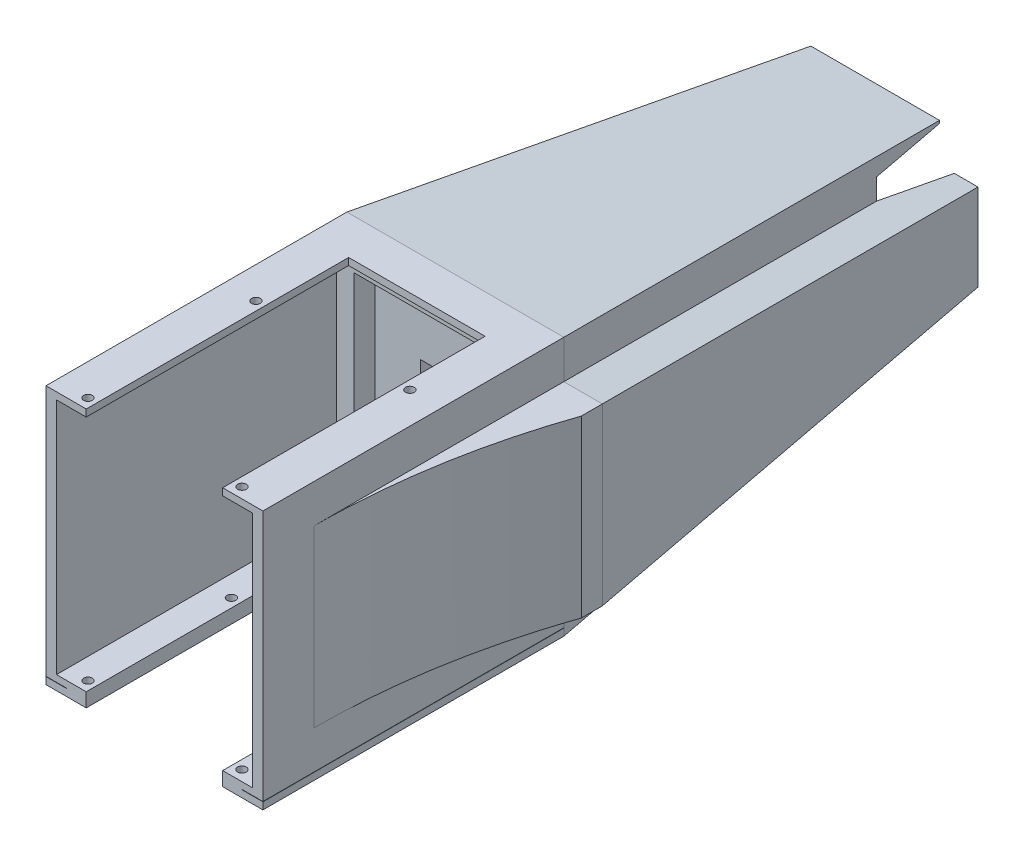
from build123d import *
from build123d.topology import SkipClean

# Parameters (mm, degrees)
BOSS_EXTRUDE1_DEPTH      = 3
SKETCH2_W                = 25
SKETCH2_H                = 2
BOSS_EXTRUDE2_DEPTH      = 40
SKETCH3_R                = 0.625
CUT_EXTRUDE1_DEPTH       = 3
SKETCH4_R                = 0.625
CUT_EXTRUDE2_DEPTH       = 3
SKETCH7_W                = 19.5
SKETCH7_H                = 75
CUT_EXTRUDE5_DEPTH       = 40
SKETCH10_W               = 25
SKETCH10_H               = 3
BOSS_EXTRUDE4_DEPTH      = 10
SKETCH11_W               = 25
SKETCH11_H               = 3
BOSS_EXTRUDE5_DEPTH      = 10
SKETCH12_W               = 3
SKETCH12_H               = 25
BOSS_EXTRUDE6_DEPTH      = 10
SKETCH13_W               = 3
SKETCH13_H               = 25
BOSS_EXTRUDE7_DEPTH      = 10
SKETCH14_W               = 43
SKETCH14_H               = 35.95813892
BOSS_EXTRUDE11_DEPTH     = 3
SKETCH15_W               = 43
SKETCH15_H               = 35.95813892
BOSS_EXTRUDE12_DEPTH     = 3
SKETCH16_W               = 23
SKETCH16_H               = 28
CUT_EXTRUDE6_DEPTH       = 13
FILLET1_R                = 10
FILLET2_R                = 10
SKETCH19_W               = 28
SKETCH19_H               = 32
CUT_EXTRUDE9_DEPTH       = 40
CUT_EXTRUDE11_DEPTH      = 58.835974964
CUT_EXTRUDE11_DEPTH_BACK = 58.835974964
SKETCH20_W               = 25.25
SKETCH20_H               = 11.847644437
SKETCH20_W_2             = 25
SKETCH20_H_2             = 13.837487399
CUT_EXTRUDE13_DEPTH      = 56.982140009
CUT_EXTRUDE13_DEPTH_BACK = 56.982140009
SKETCH22_W               = 10
SKETCH22_H               = 25
FILLET3_R                = 100
FILLET4_R                = 100
SKETCH25_W               = 28
SKETCH25_H               = 2
CUT_EXTRUDE17_DEPTH      = 40
SKETCH27_R               = 0.625
BOSS_EXTRUDE14_DEPTH     = 1
SKETCH31_W               = 10
SKETCH31_H               = 10
BOSS_EXTRUDE16_DEPTH     = 60
BOSS_EXTRUDE16_TAPER     = 6


# Some blends are built 0.0001 mm under size
with BuildPart() as part:
    # Sketch1 → Boss-Extrude1 (new body)
    with BuildSketch(Plane.XY):
        Polygon((12.5, 12.5), (21, 12.5), (21, -12.5), (12.5, -12.5), (12.5, -18), (-12.5, -18), (-12.5, -12.5), (-21, -12.5), (-21, 12.5), (-12.5, 12.5), (-12.5, 18), (12.5, 18), align=None)
    extrude(amount=BOSS_EXTRUDE1_DEPTH)

    # Sketch2 → Boss-Extrude2 (add)
    with BuildSketch(Plane.XY.offset(3)):
        with Locations((0, 17)):
            Rectangle(SKETCH2_W, SKETCH2_H)
        with Locations((0, -17)):
            Rectangle(SKETCH2_W, SKETCH2_H)
    extrude(amount=BOSS_EXTRUDE2_DEPTH)

    # Sketch3 → Cut-Extrude1 (cut)
    with BuildSketch(Plane(origin=(0, 18, 0), x_dir=(1, 0, 0), z_dir=(0, 1, 0))):
        with Locations(Location((-11, -17.5, 0), (0, 0, 270))):
            Circle(SKETCH3_R)
        with Locations(Location((11, -17.5, 0), (0, 0, 270))):
            Circle(SKETCH3_R)
        with Locations(Location((-11, -41.5, 0), (0, 0, 270))):
            Circle(SKETCH3_R)
        with Locations(Location((11, -41.5, 0), (0, 0, 270))):
            Circle(SKETCH3_R)
    extrude(amount=-CUT_EXTRUDE1_DEPTH, mode=Mode.SUBTRACT)

    # Sketch4 → Cut-Extrude2 (cut)
    with BuildSketch(Plane(origin=(0, -16, 0), x_dir=(1, 0, 0), z_dir=(0, 1, 0))):
        with Locations(Location((-11, -41.5, 0), (0, 0, 270))):
            Circle(SKETCH4_R)
        with Locations(Location((11, -41.5, 0), (0, 0, 270))):
            Circle(SKETCH4_R)
        with Locations(Location((-11, -21, 0), (0, 0, 270))):
            Circle(SKETCH4_R)
        with Locations(Location((11, -21, 0), (0, 0, 270))):
            Circle(SKETCH4_R)
    extrude(amount=-CUT_EXTRUDE2_DEPTH, mode=Mode.SUBTRACT)

    # Sketch7 → Cut-Extrude5 (cut)
    with BuildSketch(Plane(origin=(0, 18, 0), x_dir=(1, 0, 0), z_dir=(0, 1, 0))):
        with Locations((0, -43)):
            Rectangle(SKETCH7_W, SKETCH7_H)
    extrude(amount=-CUT_EXTRUDE5_DEPTH, mode=Mode.SUBTRACT)

    # Sketch10 → Boss-Extrude4 (add)
    with BuildSketch(Plane(origin=(0, 18, 0), x_dir=(1, 0, 0), z_dir=(0, 1, 0))):
        with Locations((0, -1.5)):
            Rectangle(SKETCH10_W, SKETCH10_H)
    extrude(amount=BOSS_EXTRUDE4_DEPTH)

    # Sketch11 → Boss-Extrude5 (add)
    with BuildSketch(Plane.XZ.offset(18)):
        with Locations((0, 1.5)):
            Rectangle(SKETCH11_W, SKETCH11_H)
    extrude(amount=BOSS_EXTRUDE5_DEPTH)

    # Sketch12 → Boss-Extrude6 (add)
    with BuildSketch(Plane.ZY.offset(21)):
        with Locations((1.5, 0)):
            Rectangle(SKETCH12_W, SKETCH12_H)
    extrude(amount=BOSS_EXTRUDE6_DEPTH)

    # Sketch13 → Boss-Extrude7 (add)
    with BuildSketch(Plane(origin=(21, 0, 0), x_dir=(0, 0, -1), z_dir=(1, 0, 0))):
        with Locations((-1.5, 0)):
            Rectangle(SKETCH13_W, SKETCH13_H)
    extrude(amount=BOSS_EXTRUDE7_DEPTH)

    # Sketch14 → Boss-Extrude11 (add)
    with BuildSketch(Plane.ZY.offset(12.5)):
        with Locations((21.5, 0.02093054)):
            Rectangle(SKETCH14_W, SKETCH14_H)
    extrude(amount=BOSS_EXTRUDE11_DEPTH)

    # Sketch15 → Boss-Extrude12 (add)
    with BuildSketch(Plane(origin=(12.5, 0, 0), x_dir=(0, 0, -1), z_dir=(1, 0, 0))):
        with Locations((-21.5, 0.02093054)):
            Rectangle(SKETCH15_W, SKETCH15_H)
    extrude(amount=BOSS_EXTRUDE12_DEPTH)

    # Sketch16 → Cut-Extrude6 (cut)
    with BuildSketch(Plane(origin=(0, 0, 0), x_dir=(-1, 0, 0), z_dir=(0, 0, -1))):
        Rectangle(SKETCH16_W, SKETCH16_H)
    extrude(amount=-CUT_EXTRUDE6_DEPTH, mode=Mode.SUBTRACT)

    # Fillet1
    fillet1_edges = [part.edges().sort_by_distance(p)[0] for p in [
        (31, 12.5, 1.5),
    ]]
    fillet(fillet1_edges, radius=FILLET1_R)

    # Fillet2
    fillet2_edges = [part.edges().sort_by_distance(p)[0] for p in [
        (12.5, 28, 1.5),
        (-12.5, 28, 1.5),
        (-31, 12.5, 1.5),
        (12.5, -28, 1.5),
        (-31, -12.5, 1.5),
        (-12.5, -28, 1.5),
        (31, -12.5, 1.5),
    ]]
    fillet(fillet2_edges, radius=FILLET2_R - 0.0001)  # a hair under: the kernel refuses the full size

    # Sketch19 → Cut-Extrude9 (cut)
    with BuildSketch(Plane.XY.offset(43)):
        Rectangle(SKETCH19_W, SKETCH19_H)
    extrude(amount=-CUT_EXTRUDE9_DEPTH, mode=Mode.SUBTRACT)

    # Sketch20 → Cut-Extrude11 (cut, two sides: drawn at the far end of the back side and taken through both)
    with BuildSketch(Plane.XY.offset(3).offset(-CUT_EXTRUDE11_DEPTH_BACK)):
        with Locations((0, 23.923822218)):
            Rectangle(SKETCH20_W, SKETCH20_H)
        with Locations((0, -24.918743699)):
            Rectangle(SKETCH20_W_2, SKETCH20_H_2)
    extrude(amount=CUT_EXTRUDE11_DEPTH + CUT_EXTRUDE11_DEPTH_BACK, mode=Mode.SUBTRACT)

    # Sketch22 → Cut-Extrude13 (cut, two sides: drawn at the far end of the back side and taken through both)
    with BuildSketch(Plane(origin=(0, 0, 0), x_dir=(-1, 0, 0), z_dir=(0, 0, -1)).offset(-CUT_EXTRUDE13_DEPTH_BACK)):
        with Locations((26, 0)):
            Rectangle(SKETCH22_W, SKETCH22_H)
        with Locations((-26, 0)):
            Rectangle(SKETCH22_W, SKETCH22_H)
    extrude(amount=CUT_EXTRUDE13_DEPTH + CUT_EXTRUDE13_DEPTH_BACK, mode=Mode.SUBTRACT)

    # Fillet3
    # the kernel refuses this fillet: 100 mm, written as the material it adds along each edge
    with BuildSketch(Plane(origin=(-15.5, -12.5, 3), x_dir=(0, 0, 1), z_dir=(0, 1, 0))) as fillet3_piece_1:
        with BuildLine():
            CenterArc((32.707032883, -100), FILLET3_R, 90, 19.091052513)
            Line((0, -5.5), (0, 0))
            Line((0, 0), (32.707032883, 0))
        make_face()
    extrude(amount=25)

    # Fillet4
    # the kernel refuses this fillet: 100 mm, written as the material it adds along each edge
    with BuildSketch(Plane(origin=(15.5, -12.5, 3), x_dir=(1, 0, 0), z_dir=(0, 1, 0))) as fillet4_piece_1:
        with BuildLine():
            CenterArc((100, -32.707032883), FILLET4_R, 160.908947487, 19.091052513)
            Line((0, -32.707032883), (0, 0))
            Line((0, 0), (5.5, 0))
        make_face()
    extrude(amount=25)

    # Sketch25 → Cut-Extrude17 (cut)
    with BuildSketch(Plane.XY.offset(43)):
        with Locations((0, 16)):
            Rectangle(SKETCH25_W, SKETCH25_H)
        with Locations((0, -16)):
            Rectangle(SKETCH25_W, SKETCH25_H)
    extrude(amount=-CUT_EXTRUDE17_DEPTH, mode=Mode.SUBTRACT)

    # Sketch27 → Boss-Extrude14 (add)
    with SkipClean():  # the faces are left unmerged after this step: merging them gives an invalid solid
        with BuildSketch(Plane.XZ.offset(18)):
            Polygon((-15.5, 43), (-9.75, 43), (-9.75, 5.5), (9.75, 5.5), (9.75, 43), (15.5, 43), (15.5, 0), (-15.5, 0), align=None)
            with Locations(Location((-11, 41.5, 0), (0, 0, 90))):
                Circle(SKETCH27_R, mode=Mode.SUBTRACT)
            with Locations(Location((-11, 21, 0), (0, 0, 270))):
                Circle(SKETCH27_R, mode=Mode.SUBTRACT)
            with Locations(Location((11, 21, 0), (0, 0, 270))):
                Circle(SKETCH27_R, mode=Mode.SUBTRACT)
            with Locations(Location((11, 41.5, 0), (0, 0, 90))):
                Circle(SKETCH27_R, mode=Mode.SUBTRACT)
        extrude(amount=BOSS_EXTRUDE14_DEPTH)
    add(part.part.scale(1), mode=Mode.REPLACE)  # the faces are merged on a copy

    # Sketch31 → Boss-Extrude16 (add)
    with BuildSketch(Plane(origin=(0, 0, 0), x_dir=(-1, 0, 0), z_dir=(0, 0, -1))):
        Polygon((-15.5, 18), (-15.5, 12.5), (-21, 12.5), (-21, -12.5), (-15.5, -12.5), (-15.5, -19), (15.5, -19), (15.5, -12.5), (21, -12.5), (21, 12.5), (15.5, 12.5), (15.5, 18), align=None)
        Rectangle(SKETCH31_W, SKETCH31_H, mode=Mode.SUBTRACT)
    extrude(amount=BOSS_EXTRUDE16_DEPTH, taper=BOSS_EXTRUDE16_TAPER)


solid = part.part
